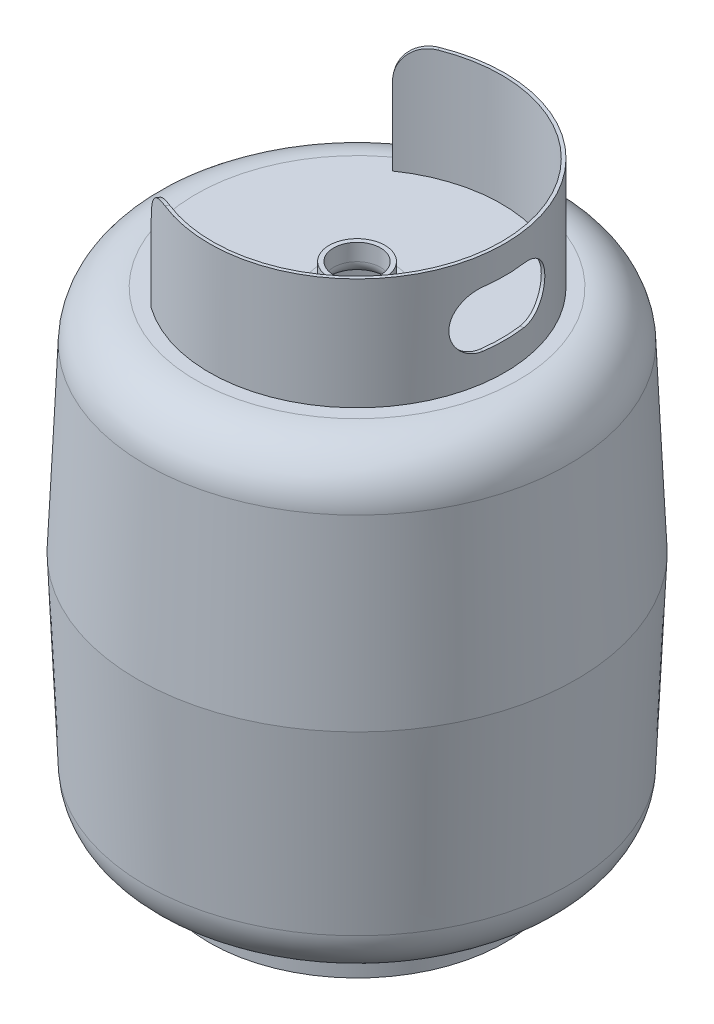
from build123d import *

# Parameters (mm, degrees)
SKETCH2_R                = 196.5
SKETCH1_R                = 187.50000000000006
FILLET1_R                = 45
CUT_EXTRUDE2_START       = -4
CUT_EXTRUDE2_OUTLINE_R   = 25
CUT_EXTRUDE2_DEPTH       = 4
BOSS_EXTRUDE3_DEPTH      = 20
BOSS_EXTRUDE3_DEPTH_BACK = 4
SKETCH8_R                = 25
SKETCH8_R_2              = 21
FILLET6_R                = 12
FILLET7_R                = 12
SKETCH9_R                = 132.4208137637083
SKETCH9_R_2              = 129.4208137637083
BOSS_EXTRUDE4_DEPTH      = 30
BOSS_EXTRUDE5_START      = 100
BOSS_EXTRUDE5_DEPTH      = 100
FILLET8_START            = -133
FILLET8_DEPTH            = 200.891870951
FILLET8_2_DEPTH          = 200.700119068
CUT_EXTRUDE3_REACH       = 641.889
CUT_EXTRUDE3_END_RADIUS  = 129.42081376370834


with BuildPart() as part:
    # Sketch2 → Loft1 section 0
    with BuildSketch(Plane(origin=(0, 206.25, 0), x_dir=(1, 0, 0), z_dir=(0, 1, 0))):
        Circle(SKETCH2_R)
    # Sketch1 → Loft1 section 1
    with BuildSketch(Plane(origin=(0, 0, 0), x_dir=(1, 0, 0), z_dir=(0, 1, 0))):
        Circle(SKETCH1_R)
    loft1 = loft()

    # Mirror1: Loft1 across plane
    add(loft1.mirror(Plane.ZX.offset(206.25)))

    # Fillet1
    fillet1_edges = [part.edges().sort_by_distance(p)[0] for p in [
        (-187.50000000000006, 0, -2.296e-14),
        (-187.50000000000006, 412.5, -2.296e-14),
    ]]
    fillet(fillet1_edges, radius=FILLET1_R)

    # Shell1: read off the stored shape, not the designer's step
    # Shell1 outline → Shell1 (revolve, cut)
    with BuildSketch(Plane.XY):
        with BuildLine():
            Line((0, 408.5), (0, 4))
            Line((0, 4), (144.420813764, 4))
            ThreePointArc((144.420813764, 4), (172.773212338, 15.383425331), (185.38183471, 43.212609995))
            Line((185.38183471, 43.212609995), (192.496193547, 206.25))
            Line((192.496193547, 206.25), (185.38183471, 369.287390005))
            ThreePointArc((185.38183471, 369.287390005), (172.773212338, 397.116574669), (144.420813764, 408.5))
            Line((144.420813764, 408.5), (0, 408.5))
        make_face()
    revolve(axis=Axis((0, 0, 0), (0, 1, 0)), mode=Mode.SUBTRACT)

    # Cut-Extrude2: read off the stored shape, not the designer's step
    # Cut-Extrude2 outline → Cut-Extrude2 (cut)
    with BuildSketch(Plane(origin=(0, 412.5, 0), x_dir=(1, 0, 0), z_dir=(0, 1, 0)).offset(CUT_EXTRUDE2_START)):
        Circle(CUT_EXTRUDE2_OUTLINE_R)
    extrude(amount=CUT_EXTRUDE2_DEPTH, mode=Mode.SUBTRACT)

    # Fillet7
    # the kernel refuses this fillet: 12 mm, written as the material it takes off along each edge
    with BuildSketch(Plane(origin=(0, 412.5, 0), x_dir=(1, 0, 0), z_dir=(0, 0, 1))) as fillet7_piece_1:
        with BuildLine():
            CenterArc((33.94427190999916, -12), FILLET7_R, 90, 48.18968510422141)
            Line((25, -4), (24.821114561800016, -3.839999999999975))
            ThreePointArc((24.821114561800016, -3.839999999999975), (24.76, -2), (24.76, 0))
            Line((24.76, 0), (25, 0.2400000000000091))
            Line((25, 0.2400000000000091), (33.94427190999916, 0.2400000000000091))
            Line((33.94427190999916, 0.2400000000000091), (33.94427190999916, 0))
        make_face()
    revolve(axis=Axis((0, 412.5, 0), (0, 1, 0)), mode=Mode.SUBTRACT)

    # Sketch9 → Boss-Extrude4 (add)
    with BuildSketch(Plane.XZ):
        with Locations(Location((0, 0, 0), (0, 0, 90))):
            Circle(SKETCH9_R)
        with Locations(Location((0, 0, 0), (0, 0, 270))):
            Circle(SKETCH9_R_2, mode=Mode.SUBTRACT)
    extrude(amount=BOSS_EXTRUDE4_DEPTH)

    # Sketch10 → Boss-Extrude5 (add)
    with BuildSketch(Plane(origin=(0, 412.5, 0), x_dir=(1, 0, 0), z_dir=(0, 1, 0)).offset(BOSS_EXTRUDE5_START)):
        with BuildLine():
            Line((-75.95345845729307, -108.47278030095376), (-74.23272914823994, -106.01532416808678))
            ThreePointArc((-74.23272914823994, -106.01532416808678), (129.42081376370834, 5.747e-14), (-74.23272914824004, 106.01532416808674))
            Line((-74.23272914824004, 106.01532416808674), (-75.95345845729317, 108.4727803009537))
            ThreePointArc((-75.95345845729317, 108.4727803009537), (132.42081376370834, 5.881e-14), (-75.95345845729307, -108.47278030095376))
        make_face()
    extrude(amount=-BOSS_EXTRUDE5_DEPTH)

    # Fillet8: read off the stored shape, not the designer's step
    # Fillet8 outline → Fillet8 (cut)
    with BuildSketch(Plane(origin=(0, 0, 0), x_dir=(0.8191520442889931, 0, -0.5735764363510442), z_dir=(0.5735764363510442, 0, 0.8191520442889932)).offset(FILLET8_START)):
        with BuildLine():
            Line((0, 512.5), (0, 482.5))
            ThreePointArc((0, 482.5), (8.786796564, 503.713203436), (30, 512.5))
            Line((30, 512.5), (0, 512.5))
        make_face()
    extrude(amount=FILLET8_DEPTH, mode=Mode.SUBTRACT)

    # Fillet8 2 outline → Fillet8 2 (cut)
    with BuildSketch(Plane(origin=(0, 0, 0), x_dir=(0.8191520442889947, 0, 0.5735764363510419), z_dir=(0.5735764363510419, 0, -0.8191520442889948)).offset(FILLET8_START)):
        with BuildLine():
            ThreePointArc((30, -512.5), (8.786796564, -503.713203436), (0, -482.5))
            Line((0, -482.5), (0, -512.5))
            Line((0, -512.5), (30, -512.5))
        make_face()
    extrude(amount=FILLET8_2_DEPTH, mode=Mode.SUBTRACT)

    # Cut-Extrude3: up to this cylinder (the profile starts outside it)
    cut_extrude3_end = Plane(origin=(0, 462.5, 0), z_dir=(0, -1, 0)) * Cylinder(CUT_EXTRUDE3_END_RADIUS, 1543.6196275274167, mode=Mode.PRIVATE)
    # Sketch11 → Cut-Extrude3 (cut, up to the surface)
    with BuildSketch(Plane(origin=(132.42081376370834, 0, 0), x_dir=(0, 0, -1), z_dir=(1, 0, 0)), mode=Mode.PRIVATE) as cut_extrude3_sk1:
        with BuildLine():
            Line((18.000000000000057, 437.5), (-18.00000000000005, 437.5))
            ThreePointArc((-18.00000000000005, 437.5), (-43.00000000000006, 462.49999999999994), (-18.000000000000053, 487.49999999999994))
            Line((-18.000000000000053, 487.49999999999994), (17.999999999999932, 487.5))
            ThreePointArc((17.999999999999932, 487.5), (43, 462.5), (18.000000000000057, 437.5))
        make_face()
    cut_extrude3_tool1 = extrude(cut_extrude3_sk1.sketch, amount=-CUT_EXTRUDE3_REACH, mode=Mode.PRIVATE) - cut_extrude3_end
    add(cut_extrude3_tool1.solids().sort_by_distance((132.420814, 462.5, 0))[0], mode=Mode.SUBTRACT)


with BuildPart() as body_2:
    # Sketch8 → Boss-Extrude3 (new, two sides: drawn at the far end of the back side and taken through both)
    with BuildSketch(Plane(origin=(0, 412.5, 0), x_dir=(1, 0, 0), z_dir=(0, 1, 0)).offset(-BOSS_EXTRUDE3_DEPTH_BACK)):
        with Locations(Location((0, 0, 0), (0, 0, 270))):
            Circle(SKETCH8_R)
        with Locations(Location((0, 0, 0), (0, 0, 270))):
            Circle(SKETCH8_R_2, mode=Mode.SUBTRACT)
    extrude(amount=BOSS_EXTRUDE3_DEPTH + BOSS_EXTRUDE3_DEPTH_BACK)

    # Fillet6
    # the kernel refuses this fillet: 12 mm, written as the material it takes off along each edge
    with BuildSketch(Plane(origin=(0, 408.5, 0), x_dir=(-1.8e-16, 0, 1), z_dir=(-1, 0, -1.8e-16))) as fillet6_piece_1:
        with BuildLine():
            CenterArc((33, 8.944271909999145), FILLET6_R, 180, 48.189685104221326)
            Line((21, 8.944271909999145), (20.76, 8.944271909999145))
            Line((20.76, 8.944271909999145), (20.76, 0))
            Line((20.76, 0), (21, -0.2400000000000091))
            ThreePointArc((21, -0.2400000000000091), (22.999999999999996, -0.2400000000000091), (24.839999999999993, -0.17888543819998404))
            Line((24.839999999999993, -0.17888543819998404), (24.999999999999993, 0))
        make_face()
    revolve(axis=Axis((0, 408.5, 0), (0, 1, 0)), mode=Mode.SUBTRACT)


solid = Compound([part.part, body_2.part])
